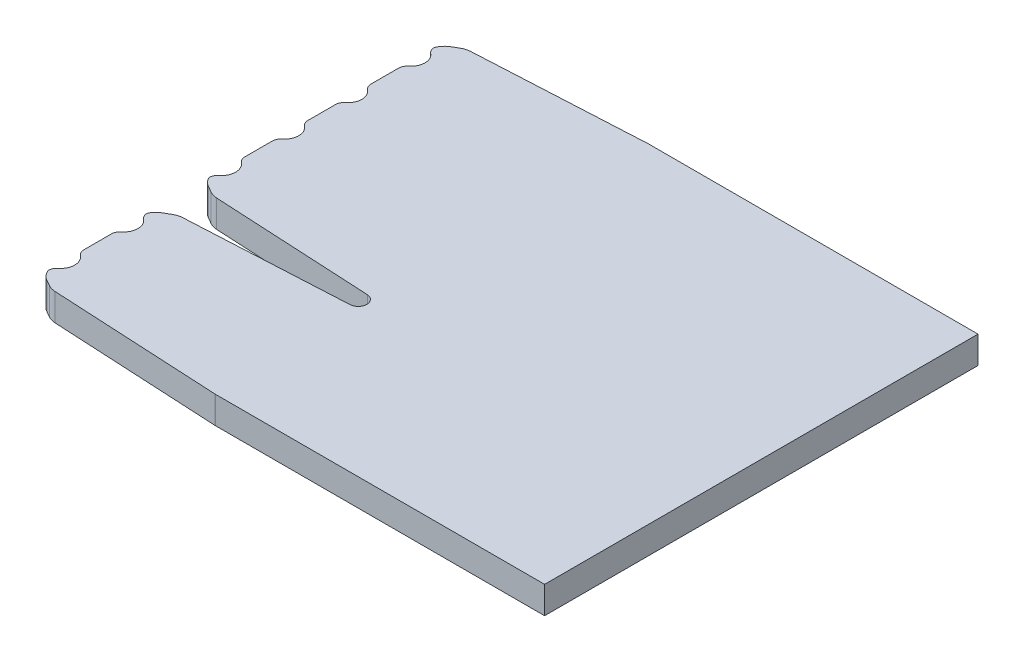
from build123d import *

# Parameters (mm, degrees)
SKETCH1_W               = 30
SKETCH1_H               = 25
BOSS_EXTRUDE1_DEPTH     = 1.57
CUT_EXTRUDE1_DEPTH      = 33.53789944
SKETCH2_W               = 11
SKETCH2_H               = 1.5
BOSS_EXTRUDE2_DEPTH     = 0.05
CUT_EXTRUDE2_DEPTH      = 33.53789944
CUT_EXTRUDE2_DEPTH_BACK = 33.53789944
FILLET1_R               = 1


with BuildPart() as part:
    # Sketch1 → Boss-Extrude1 (new body)
    with BuildSketch(Plane(origin=(0, 0, 0), x_dir=(1, 0, 0), z_dir=(0, 1, 0))):
        with Locations((15, 0)):
            Rectangle(SKETCH1_W, SKETCH1_H)
    extrude(amount=BOSS_EXTRUDE1_DEPTH)

    # Sketch3 → Cut-Extrude1 (cut, through all)
    with BuildSketch(Plane(origin=(0, 0, 0), x_dir=(1, 0, 0), z_dir=(0, 1, 0))):
        with BuildLine():
            Line((10.41339187, -4.139314767), (1, -4.632649731))
            Line((1, -4.632649731), (0, -5.21))
            Line((0, -5.21), (0, -2.07))
            Line((0, -2.07), (1, -2.647350269))
            Line((1, -2.647350269), (10.41339187, -3.140685233))
            ThreePointArc((10.41339187, -3.140685233), (10.887223892, -3.64), (10.41339187, -4.139314767))
        make_face()
        Polygon((11, 12.5), (1, 11.975922207), (0, 11.398571938), (0, 12.5), align=None)
        Polygon((11, -12.5), (0, -12.5), (0, -11.398571938), (1, -11.975922207), align=None)
    extrude(amount=CUT_EXTRUDE1_DEPTH, mode=Mode.SUBTRACT)

    # Sketch2 → Boss-Extrude2 (add)
    with BuildSketch(Plane(origin=(0, 0, 0), x_dir=(1, 0, 0), z_dir=(0, 1, 0))):
        with Locations((5.5, -10.1)):
            Rectangle(SKETCH2_W, SKETCH2_H)
        with Locations((5.5, -6.46)):
            Rectangle(SKETCH2_W, SKETCH2_H)
        with Locations((5.5, -0.82)):
            Rectangle(SKETCH2_W, SKETCH2_H)
        with Locations((5.5, 2.82)):
            Rectangle(SKETCH2_W, SKETCH2_H)
        with Locations((5.5, 6.46)):
            Rectangle(SKETCH2_W, SKETCH2_H)
        with Locations((5.5, 10.1)):
            Rectangle(SKETCH2_W, SKETCH2_H)
    extrude(amount=-BOSS_EXTRUDE2_DEPTH)

    # Sketch4 → Cut-Extrude2 (cut, two sides: drawn at the far end of the back side and taken through both)
    with BuildSketch(Plane(origin=(0, 0, 0), x_dir=(1, 0, 0), z_dir=(0, 1, 0)).offset(-CUT_EXTRUDE2_DEPTH_BACK)):
        with BuildLine():
            Line((0, -11.130776406), (0, -9.069223594))
            ThreePointArc((0, -9.069223594), (0.050132295, -9.287441484), (0.19047619, -9.46190032))
            ThreePointArc((0.19047619, -9.46190032), (0.5, -10.1), (0.19047619, -10.73809968))
            ThreePointArc((0.19047619, -10.73809968), (0.050132295, -10.912558516), (0, -11.130776406))
        make_face()
        with BuildLine():
            Line((0, -5.429223594), (0, -7.490776406))
            ThreePointArc((0, -7.490776406), (0.050132295, -7.272558516), (0.19047619, -7.09809968))
            ThreePointArc((0.19047619, -7.09809968), (0.5, -6.46), (0.19047619, -5.82190032))
            ThreePointArc((0.19047619, -5.82190032), (0.050132295, -5.647441484), (0, -5.429223594))
        make_face()
        with BuildLine():
            Line((0, -1.850776406), (0, 0.210776406))
            ThreePointArc((0, 0.210776406), (0.050132295, -0.007441484), (0.19047619, -0.18190032))
            ThreePointArc((0.19047619, -0.18190032), (0.5, -0.82), (0.19047619, -1.45809968))
            ThreePointArc((0.19047619, -1.45809968), (0.050132295, -1.632558516), (0, -1.850776406))
        make_face()
        with BuildLine():
            Line((0, 3.850776406), (0, 1.789223594))
            ThreePointArc((0, 1.789223594), (0.050132295, 2.007441484), (0.19047619, 2.18190032))
            ThreePointArc((0.19047619, 2.18190032), (0.5, 2.82), (0.19047619, 3.45809968))
            ThreePointArc((0.19047619, 3.45809968), (0.050132295, 3.632558516), (0, 3.850776406))
        make_face()
        with BuildLine():
            Line((0, 5.429223594), (0, 7.490776406))
            ThreePointArc((0, 7.490776406), (0.050132295, 7.272558516), (0.19047619, 7.09809968))
            ThreePointArc((0.19047619, 7.09809968), (0.5, 6.46), (0.19047619, 5.82190032))
            ThreePointArc((0.19047619, 5.82190032), (0.050132295, 5.647441484), (0, 5.429223594))
        make_face()
        with BuildLine():
            Line((0, 11.130776406), (0, 9.069223594))
            ThreePointArc((0, 9.069223594), (0.050132295, 9.287441484), (0.19047619, 9.46190032))
            ThreePointArc((0.19047619, 9.46190032), (0.5, 10.1), (0.19047619, 10.73809968))
            ThreePointArc((0.19047619, 10.73809968), (0.050132295, 10.912558516), (0, 11.130776406))
        make_face()
    extrude(amount=CUT_EXTRUDE2_DEPTH + CUT_EXTRUDE2_DEPTH_BACK, mode=Mode.SUBTRACT)

    # Fillet1
    # the kernel refuses this fillet: 1 mm, written as the material it takes off along each edge
    with BuildSketch(Plane(origin=(1, -0.600196898, -11.975922207), x_dir=(0.998629534754574, 0, -0.0523359562429405), z_dir=(0, 1, 0)), Plane(origin=(1, -0.600196898, 4.632649731), x_dir=(0.9986295347545742, 0, -0.05233595624293651), z_dir=(0, 1, 0)), Plane(origin=(1, -0.600196898, 2.647350269), x_dir=(-0.8660254037844378, 0, -0.5000000000000013), z_dir=(0, 1, 0))) as fillet1_piece_1:
        with BuildLine():
            CenterArc((FILLET1_R * 0.24007875908, -FILLET1_R), FILLET1_R, 90, 27)
            Line((-FILLET1_R * 0.213911740659, -FILLET1_R * 0.108993475812), (-FILLET1_R * 0.222991550654, -FILLET1_R * 0.0911733453279))
            Line((-FILLET1_R * 0.222991550654, -FILLET1_R * 0.0911733453279), (-FILLET1_R * 0.0048015751816, FILLET1_R * 0.02))
            Line((-FILLET1_R * 0.0048015751816, FILLET1_R * 0.02), (FILLET1_R * 0.24007875908, FILLET1_R * 0.02))
            Line((FILLET1_R * 0.24007875908, FILLET1_R * 0.02), (FILLET1_R * 0.24007875908, 0))
        make_face()
    extrude(amount=2.770393795, mode=Mode.SUBTRACT)
    with BuildSketch(Plane(origin=(0, -1.266133532, -11.398571938), x_dir=(0.8660254037844373, 0, -0.5000000000000024), z_dir=(0, 1, 0))) as fillet1_piece_2:
        with BuildLine():
            CenterArc((0.506453413, -1), FILLET1_R, 90, 39.818010975)
            Line((-0.133897766, -0.231917733), (-0.146704789, -0.216556088))
            ThreePointArc((-0.146704789, -0.216556088), (-0.084269391, -0.105958867), (-0.017320508, 0.01))
            Line((-0.017320508, 0.01), (0, 0.02))
            Line((0, 0.02), (0.506453413, 0.02))
            Line((0.506453413, 0.02), (0.506453413, 0))
        make_face()
    extrude(amount=4.102267063, mode=Mode.SUBTRACT)
    with BuildSketch(Plane(origin=(0, -1.191538155, 5.21), x_dir=(0.8660254037844375, 0, -0.500000000000002), z_dir=(0, 1, 0))) as fillet1_piece_3:
        with BuildLine():
            CenterArc((0.476615262, -1), FILLET1_R, 90, 35.889723461)
            Line((-0.109611797, -0.189853201), (-0.121336338, -0.173650265))
            ThreePointArc((-0.121336338, -0.173650265), (-0.072126406, -0.084926601), (-0.017320508, 0.01))
            Line((-0.017320508, 0.01), (0, 0.02))
            Line((0, 0.02), (0.476615262, 0.02))
            Line((0.476615262, 0.02), (0.476615262, 0))
        make_face()
    extrude(amount=3.953076309, mode=Mode.SUBTRACT)
    with BuildSketch(Plane(origin=(0, -1.191538155, 2.07), x_dir=(0, 0, -1), z_dir=(0, 1, 0))) as fillet1_piece_4:
        with BuildLine():
            CenterArc((0.627717773, -0.912760925), FILLET1_R, 114.110276539, 35.889723461)
            Line((-0.238307631, -0.412760925), (-0.255628139, -0.402760925))
            Line((-0.255628139, -0.402760925), (-0.017320508, 0.01))
            Line((-0.017320508, 0.01), (0, 0.02))
            ThreePointArc((0, 0.02), (0.109611797, 0.02), (0.21105371, 0.018255218))
            Line((0.21105371, 0.018255218), (0.219223594, 0))
        make_face()
    extrude(amount=3.953076309, mode=Mode.SUBTRACT)
    with BuildSketch(Plane(origin=(0, -1.266133532, 11.398571938), x_dir=(3.4310526757958135e-12, 0, -1.0), z_dir=(0, 1, 0))) as fillet1_piece_5:
        with BuildLine():
            CenterArc((0.612798697, -0.938601521), FILLET1_R, 110.181989025, 39.818010975)
            Line((-0.253226706, -0.438601521), (-0.270547214, -0.428601521))
            Line((-0.270547214, -0.428601521), (-0.017320508, 0.01))
            Line((-0.017320508, 0.01), (0, 0.02))
            ThreePointArc((0, 0.02), (0.133897766, 0.02), (0.260895468, 0.01877203))
            Line((0.260895468, 0.01877203), (0.267795532, 0))
        make_face()
    extrude(amount=4.102267063, mode=Mode.SUBTRACT)
    with BuildSketch(Plane(origin=(1, -0.600196898, 11.975922207), x_dir=(0.998629534754574, 0, 0.0523359562429404), z_dir=(0, 1, 0))) as fillet1_piece_6:
        with BuildLine():
            CenterArc((FILLET1_R * 0.24007875908, FILLET1_R), FILLET1_R, 243, 27)
            Line((-FILLET1_R * 0.213911740659, FILLET1_R * 0.108993475812), (-FILLET1_R * 0.222991550654, FILLET1_R * 0.0911733453279))
            Line((-FILLET1_R * 0.222991550654, FILLET1_R * 0.0911733453279), (-FILLET1_R * 0.0048015751816, -FILLET1_R * 0.02))
            Line((-FILLET1_R * 0.0048015751816, -FILLET1_R * 0.02), (FILLET1_R * 0.24007875908, -FILLET1_R * 0.02))
            Line((FILLET1_R * 0.24007875908, -FILLET1_R * 0.02), (FILLET1_R * 0.24007875908, 0))
        make_face()
    extrude(amount=2.770393795, mode=Mode.SUBTRACT)
    with BuildSketch(Plane(origin=(11, -0.065464804, -12.5), x_dir=(-0.998629534754574, 0, 0.05233595624294029), z_dir=(0, 1, 0)), Plane(origin=(11, -0.065464804, 12.5), x_dir=(1, 0, 0), z_dir=(0, 1, 0))) as fillet1_piece_7:
        with BuildLine():
            CenterArc((FILLET1_R * 0.0261859215692, FILLET1_R), FILLET1_R, 267, 3)
            Line((-FILLET1_R * 0.0261500346738, FILLET1_R * 0.00137046524543), (-FILLET1_R * 0.0271967537986, -FILLET1_R * 0.0186021254497))
            Line((-FILLET1_R * 0.0271967537986, -FILLET1_R * 0.0186021254497), (-FILLET1_R * 0.000523718431384, -FILLET1_R * 0.02))
            Line((-FILLET1_R * 0.000523718431384, -FILLET1_R * 0.02), (FILLET1_R * 0.0261859215692, -FILLET1_R * 0.02))
            Line((FILLET1_R * 0.0261859215692, -FILLET1_R * 0.02), (FILLET1_R * 0.0261859215692, 0))
        make_face()
    extrude(amount=1.700929608, mode=Mode.SUBTRACT)


solid = part.part
